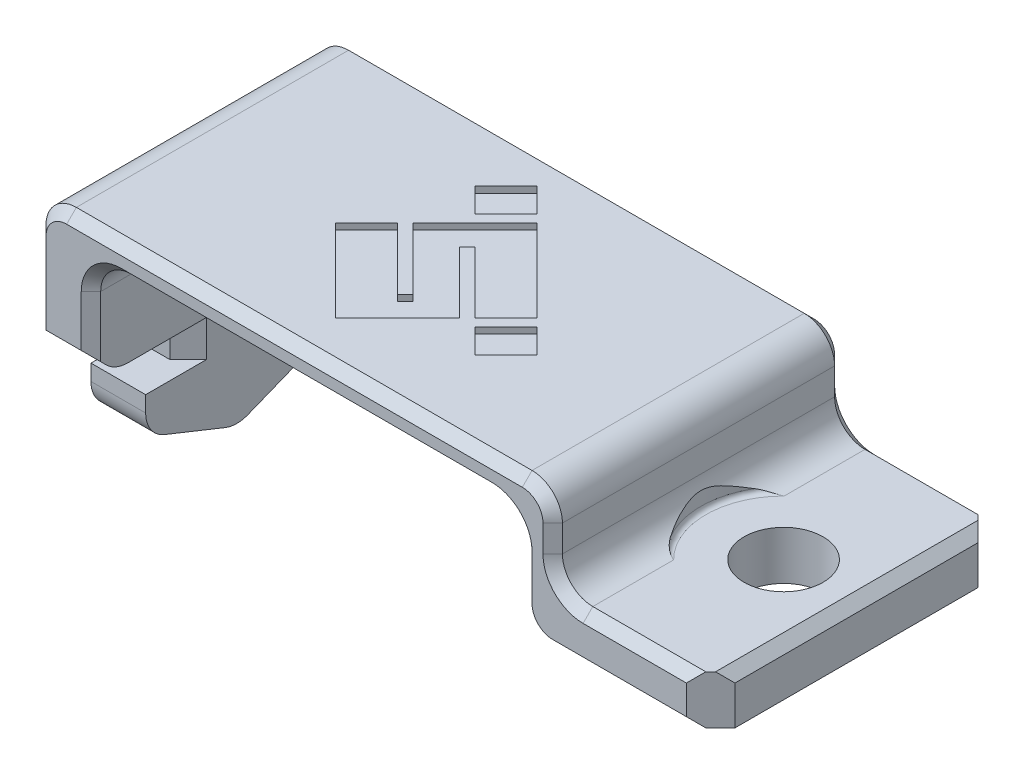
from build123d import *

# Parameters (mm, degrees)
BOSS_BODY_DEPTH           = 12
FILLET1_R                 = 2.5
CUT_NOTCH_DEPTH           = 38.330450037
BOSS_FINGER_DEPTH         = 2.5
BOSS_PRESS_DEPTH          = 12
CHAMFER3_SIZE             = 3
CUT_MOUNT_HOLE_DEPTH      = 38.330450037
CUT_MOUNT_HOLE_DEPTH_BACK = 38.330450037
SKETCH6_R                 = 3.25
FILLET_OVERHANG_R         = 2.5
CHAMFER1_SIZE             = 2
FILLET2_R                 = 2.5
CHAMF_MAIN_FACES_SIZE     = 0.8
CHAMFER4_SIZE             = 1.5
CUT_LOGO_DEPTH            = 0.5
CUT_VERSION_DEPTH         = 0.5


with BuildPart() as part:
    # Sketch1 → boss_body (new, symmetric)
    with BuildSketch(Plane.XY):
        Polygon((-17.75, -9.5), (-17.75, 9.5), (17.75, 9.5), (17.75, 0.8), (33.25, 0.8), (33.25, 4.8), (20.25, 4.8), (20.25, 12), (-22.25, 12), (-22.25, -9.5), align=None)
    extrude(amount=BOSS_BODY_DEPTH, both=True)

    # Fillet1
    fillet1_edges = [part.edges().sort_by_distance(p)[0] for p in [
        (-22.25, 12, 0),
        (20.25, 12, 0),
        (20.25, 4.8, 0),
        (17.75, 9.5, 0),
        (-17.75, 9.5, 0),
    ]]
    fillet(fillet1_edges, radius=FILLET1_R)

    # Sketch2 → cut-notch (cut, through all)
    with BuildSketch(Plane(origin=(0, 0, 0), x_dir=(0, 0, -1), z_dir=(1, 0, 0))):
        Polygon((-7.5, -2.2), (-7.5, -5.2), (0, -8.2), (7.5, -5.2), (7.5, -2.2), (4, -2.2), (4, 0.8), (12, 0.8), (12, -3.635963145), (12, -9.5), (-12, -9.5), (-12, 0.8), (-4, 0.8), (-4, -2.2), align=None)
    extrude(amount=-CUT_NOTCH_DEPTH, mode=Mode.SUBTRACT)

    # Sketch3 → boss_finger (add)
    with BuildSketch(Plane.ZY.offset(-17.75)):
        Polygon((-5, 0.8), (-1, -3.2), (1, -3.2), (5, 0.8), align=None)
    extrude(amount=-BOSS_FINGER_DEPTH)

    # Sketch6 → cut_mount_hole (cut, two sides: drawn at the far end of the back side and taken through both)
    with BuildSketch(Plane(origin=(0, 0, 0), x_dir=(1, 0, 0), z_dir=(0, 1, 0)).offset(-CUT_MOUNT_HOLE_DEPTH_BACK)):
        with Locations(Location((27.25, 0, 0), (0, 0, 90))):
            Circle(SKETCH6_R)
    extrude(amount=CUT_MOUNT_HOLE_DEPTH + CUT_MOUNT_HOLE_DEPTH_BACK, mode=Mode.SUBTRACT)

    # fillet overhang
    fillet_overhang_edges = [part.edges().sort_by_distance(p)[0] for p in [
        (17.75, 0.8, 8.5),
        (17.75, 0.8, -8.5),
    ]]
    fillet(fillet_overhang_edges, radius=FILLET_OVERHANG_R)

    # Chamfer1
    chamfer1_edges = [part.edges().sort_by_distance(p)[0] for p in [
        (33.25, 2.8, -12),
        (33.25, 2.8, 12),
        (-20, 0.8, -12),
        (-20, 0.8, 12),
    ]]
    chamfer(chamfer1_edges, length=CHAMFER1_SIZE)

    # Fillet2
    fillet2_edges = [part.edges().sort_by_distance(p)[0] for p in [
        (-20, 0.8, -10),
        (-20, 0.8, 10),
        (-20, -5.2, 7.5),
        (-20, -8.2, 0),
        (-20, -5.2, -7.5),
    ]]
    fillet(fillet2_edges, radius=FILLET2_R)

    # chamf_main_faces
    chamf_main_faces_edges = [part.edges().sort_by_distance(p)[0] for p in [
        (25.75, 0.8, -12),
        (25.75, 0.8, 12),
        (18.482233047, 1.532233047, 12),
        (18.482233047, 1.532233047, -12),
        (33.25, 4.8, 0),
        (27, 4.8, -12),
        (27, 4.8, 12),
        (-17.75, 4.9, -12),
        (-17.75, 4.9, 12),
        (20.25, 8.4, -12),
        (20.25, 8.4, 12),
        (-1, 12, -12),
        (-1, 12, 12),
        (-22.25, 6.15, -12),
        (17.75, 5.15, -12),
        (0, 9.5, -12),
        (-21.517766953, 11.267766953, -12),
        (19.517766953, 11.267766953, -12),
        (0, 9.5, 12),
        (17.75, 5.15, 12),
        (-22.25, 6.15, 12),
        (-21.517766953, 11.267766953, 12),
        (19.517766953, 11.267766953, 12),
        (20.982233047, 5.532233047, -12),
        (20.982233047, 5.532233047, 12),
        (17.017766953, 8.767766953, -12),
        (17.017766953, 8.767766953, 12),
        (-17.017766953, 8.767766953, -12),
        (-17.017766953, 8.767766953, 12),
    ]]
    chamfer(chamf_main_faces_edges, length=CHAMF_MAIN_FACES_SIZE)

    # Chamfer4
    chamfer4_edges = [part.edges().sort_by_distance(p)[0] for p in [
        (-17.75, -0.7, 4),
        (-22.25, -0.7, 4),
        (-17.75, -0.7, -4),
        (-22.25, -0.7, -4),
    ]]
    chamfer(chamfer4_edges, length=CHAMFER4_SIZE)

    # Sketch7 → m6_clearance (revolve, cut)
    with BuildSketch(Plane.XY):
        with BuildLine():
            Line((27.25, 4.8), (20.85, 4.8))
            ThreePointArc((20.85, 4.8), (20.567157288, 4.917157288), (20.45, 5.2))
            Line((20.45, 5.2), (20.45, 8.8))
            Line((20.45, 8.8), (27.25, 8.8))
            Line((27.25, 8.8), (27.25, 4.8))
        make_face()
    revolve(axis=Axis((27.25, 4.8, 0), (0, -1, 0)), mode=Mode.SUBTRACT)

    # Sketch9 → cut_LOGO (cut)
    with BuildSketch(Plane(origin=(0, 12, 0), x_dir=(1, 0, 0), z_dir=(0, 1, 0))):
        Polygon((-5.421740566, 0.907042417), (-0.330571742, -4.184126407), (0.305824361, -3.547730304), (-4.785344463, 1.54343852), (0.305824361, 6.634607345), (7.094049461, -0.153617755), (4.548465048, -2.699202167), (-0.542703776, 2.391966658), (-1.179099879, 1.755570555), (3.912068945, -3.33559827), (-1.179099879, -8.426767094), (-7.967324979, -1.638541995), align=None)
        Polygon((-2.310470729, 9.250902435), (-0.330571742, 7.271003448), (-2.876156154, 4.725419036), (-4.856055141, 6.705318023), align=None)
        Polygon((9.710344551, -2.769912845), (7.164760139, -5.315497257), (5.184861151, -3.33559827), (7.730445564, -0.790013858), align=None)
    extrude(amount=-CUT_LOGO_DEPTH, mode=Mode.SUBTRACT)

    # Sketch10 → cut_version (cut)
    with BuildSketch(Plane.XZ.offset(-9.5)):
        with BuildLine():
            add(Edge.make_bspline(
                [(-14.851008321, -4.237689198), (-14.849510693, -4.250642601), (-14.846610294, -4.27572897), (-14.8384834, -4.299632501), (-14.834552846, -4.31119339)],
                knots=[0, 0, 0, 0, 1.032704525, 2, 2, 2, 2], degree=3))
            Line((-14.834552846, -4.31119339), (-14.036166159, -6.698768815))
            add(Edge.make_bspline(
                [(-14.036166159, -6.698768815), (-14.027439153, -6.719711122), (-14.010827911, -6.75957333), (-13.965521002, -6.805388656), (-13.909705028, -6.836792705), (-13.867228102, -6.842414168), (-13.845121951, -6.845339731)],
                knots=[0, 0, 0, 0, 1.054683453, 2.007515722, 2.96305683, 4, 4, 4, 4], degree=3))
            add(Edge.make_bspline(
                [(-13.845121951, -6.845339731), (-13.821946344, -6.842462796), (-13.77791748, -6.836997213), (-13.720080391, -6.805920093), (-13.674632812, -6.759562125), (-13.657942961, -6.719838441), (-13.649186992, -6.698998268)],
                knots=[0, 0, 0, 0, 1.06836729, 2.029677035, 2.966312611, 4, 4, 4, 4], degree=3))
            Line((-13.649186992, -6.698998268), (-12.850430323, -4.310568548))
            add(Edge.make_bspline(
                [(-12.850430323, -4.310568548), (-12.847467979, -4.299182453), (-12.84127803, -4.275390694), (-12.840063949, -4.250829517), (-12.839430894, -4.238022658)],
                knots=[0, 0, 0, 0, 0.957146177, 2, 2, 2, 2], degree=3))
            add(Edge.make_bspline(
                [(-12.839430894, -4.238022658), (-12.840513149, -4.224642478), (-12.842607672, -4.198747385), (-12.854807937, -4.161929293), (-12.87241906, -4.127978683), (-12.898096672, -4.09899106), (-12.928280689, -4.074515682), (-12.962352667, -4.055193007), (-13.001208379, -4.044819109), (-13.027996369, -4.042484031), (-13.041869919, -4.04127469)],
                knots=[0, 0, 0, 0, 1.027789528, 1.989114056, 2.957849911, 3.946954469, 4.938684973, 5.935646619, 6.930867606, 8, 8, 8, 8], degree=3))
            add(Edge.make_bspline(
                [(-13.041869919, -4.04127469), (-13.063921833, -4.044287864), (-13.106166507, -4.050060176), (-13.162795828, -4.080245643), (-13.207225975, -4.127043825), (-13.224109634, -4.166835597), (-13.232926829, -4.187616154)],
                knots=[0, 0, 0, 0, 1.03692919, 1.986436811, 2.948451835, 4, 4, 4, 4], degree=3))
            Line((-13.232926829, -4.187616154), (-13.845099721, -6.009218034))
            Line((-13.845099721, -6.009218034), (-14.452016641, -4.187234262))
            add(Edge.make_bspline(
                [(-14.452016641, -4.187234262), (-14.460984425, -4.16657545), (-14.478249838, -4.126801641), (-14.523590639, -4.079943592), (-14.582230408, -4.049827719), (-14.626053694, -4.044229736), (-14.649186992, -4.04127469)],
                knots=[0, 0, 0, 0, 1.028913269, 1.980936724, 2.934183284, 4, 4, 4, 4], degree=3))
            add(Edge.make_bspline(
                [(-14.649186992, -4.04127469), (-14.662519835, -4.042496339), (-14.688503341, -4.044877131), (-14.726503219, -4.055343464), (-14.760433978, -4.07472833), (-14.791327925, -4.098930726), (-14.817711885, -4.127950064), (-14.836391525, -4.161711831), (-14.848399917, -4.198772275), (-14.850526959, -4.224650957), (-14.851008321, -4.237689198)],
                knots=[0, 0, 0, 0, 1.030543514, 2.008358934, 3.007991962, 4.018680577, 5.024181706, 6.005556065, 6.969456486, 8, 8, 8, 8], degree=3))
        make_face()
        with BuildLine():
            add(Edge.make_bspline(
                [(-11.82333905, -3.695182528), (-11.83267289, -3.704485782), (-11.851155193, -3.722907521), (-11.871007144, -3.757086289), (-11.882445754, -3.795589802), (-11.884639454, -3.822499517), (-11.885772358, -3.836396642)],
                knots=[0, 0, 0, 0, 0.992164211, 1.96462331, 2.948859839, 4, 4, 4, 4], degree=3))
            add(Edge.make_bspline(
                [(-11.885772358, -3.836396642), (-11.884679287, -3.850311158), (-11.882562718, -3.87725455), (-11.870583694, -3.91549404), (-11.852817897, -3.950495641), (-11.827077267, -3.980137182), (-11.797432861, -4.005895186), (-11.762425379, -4.023595181), (-11.724240999, -4.035819418), (-11.697255506, -4.037272826), (-11.683333333, -4.038022658)],
                knots=[0, 0, 0, 0, 1.0530203, 2.0390173, 3.01127151, 4.001099292, 4.990927074, 5.963181283, 6.949178283, 8, 8, 8, 8], degree=3))
            add(Edge.make_bspline(
                [(-11.683333333, -4.038022658), (-11.668876995, -4.036639992), (-11.640821824, -4.033956676), (-11.601356851, -4.021541028), (-11.566018655, -4.002684568), (-11.546693244, -3.985074373), (-11.53699187, -3.97623404)],
                knots=[0, 0, 0, 0, 1.06971459, 2.075976935, 3.034138695, 4, 4, 4, 4], degree=3))
            Line((-11.53699187, -3.97623404), (-11.072953189, -3.501333284))
            Line((-11.072953189, -3.501333284), (-11.072953189, -6.642707776))
            add(Edge.make_bspline(
                [(-11.072953189, -6.642707776), (-11.072125061, -6.656689848), (-11.070523803, -6.683725402), (-11.05839408, -6.72203276), (-11.040543394, -6.756701394), (-11.015761185, -6.786937016), (-10.986131809, -6.812093635), (-10.951928166, -6.83018716), (-10.914441026, -6.842121481), (-10.888032281, -6.844243536), (-10.874390244, -6.845339731)],
                knots=[0, 0, 0, 0, 1.064897874, 2.059072668, 3.039390689, 4.024276954, 5.022314302, 5.984364611, 6.958777708, 8, 8, 8, 8], degree=3))
            add(Edge.make_bspline(
                [(-10.874390244, -6.845339731), (-10.860758639, -6.844209483), (-10.834111371, -6.842000058), (-10.796244417, -6.830376547), (-10.761863409, -6.812065292), (-10.732117867, -6.786982574), (-10.707663161, -6.75645035), (-10.688300065, -6.722428492), (-10.677936969, -6.683559386), (-10.675600372, -6.65677328), (-10.674390244, -6.642900707)],
                knots=[0, 0, 0, 0, 1.038553346, 2.030179789, 2.989764092, 3.985243189, 4.967604913, 5.955148361, 6.940967594, 8, 8, 8, 8], degree=3))
            Line((-10.674390244, -6.642900707), (-10.674390244, -3.044887972))
            add(Edge.make_bspline(
                [(-10.674390244, -3.044887972), (-10.675632713, -3.031441958), (-10.678067627, -3.005091307), (-10.688284129, -2.966611433), (-10.707705574, -2.932651846), (-10.731856851, -2.902025519), (-10.762149659, -2.877867847), (-10.796213335, -2.859497816), (-10.834069834, -2.847680431), (-10.860754169, -2.846131339), (-10.874390244, -2.845339731)],
                knots=[0, 0, 0, 0, 1.033276339, 2.024949948, 3.018358012, 4.006553579, 4.994749146, 5.960032027, 6.957547333, 8, 8, 8, 8], degree=3))
            add(Edge.make_bspline(
                [(-10.874390244, -2.845339731), (-10.888023181, -2.84613127), (-10.914442068, -2.847665173), (-10.952137, -2.859323021), (-10.985297274, -2.879247689), (-11.00345026, -2.897243307), (-11.012601626, -2.906315341)],
                knots=[0, 0, 0, 0, 1.049879887, 2.034532876, 3.009159723, 4, 4, 4, 4], degree=3))
            Line((-11.012601626, -2.906315341), (-11.82333905, -3.695182528))
        make_face()
        with BuildLine():
            add(Edge.make_bspline(
                [(-9.728728404, -6.635056449), (-9.728012298, -6.649144484), (-9.726619201, -6.676551023), (-9.714651661, -6.7153126), (-9.696460833, -6.750535574), (-9.671312956, -6.780997064), (-9.641066861, -6.806504311), (-9.606369893, -6.825602642), (-9.56752699, -6.837268615), (-9.540323434, -6.838843783), (-9.526422764, -6.839648674)],
                knots=[0, 0, 0, 0, 1.053795159, 2.050028647, 3.013195991, 4.009429478, 4.990006149, 5.962765968, 6.958999455, 8, 8, 8, 8], degree=3))
            add(Edge.make_bspline(
                [(-9.526422764, -6.839648674), (-9.512512571, -6.838877458), (-9.485550297, -6.837382603), (-9.447077344, -6.825414812), (-9.41258711, -6.806520991), (-9.382346223, -6.780992542), (-9.357199819, -6.750536569), (-9.338998029, -6.715312975), (-9.327125464, -6.67671294), (-9.325584276, -6.649492785), (-9.324796748, -6.635583633)],
                knots=[0, 0, 0, 0, 1.045213593, 2.025948432, 3.002645121, 3.987190297, 4.987455656, 5.954521048, 6.954786407, 8, 8, 8, 8], degree=3))
            Line((-9.324796748, -6.635583633), (-9.324117124, -6.43614734))
            add(Edge.make_bspline(
                [(-9.324117124, -6.43614734), (-9.325169736, -6.421780314), (-9.327215087, -6.393863464), (-9.339020065, -6.354304414), (-9.356744261, -6.318421207), (-9.382432123, -6.288548397), (-9.41260967, -6.263729392), (-9.447295228, -6.245902463), (-9.48552471, -6.233733642), (-9.512503863, -6.232272444), (-9.526422764, -6.231518593)],
                knots=[0, 0, 0, 0, 1.076562654, 2.091889952, 3.072719245, 4.052917712, 5.020200157, 5.982996012, 6.959400964, 8, 8, 8, 8], degree=3))
            add(Edge.make_bspline(
                [(-9.526422764, -6.231518593), (-9.540332156, -6.232306133), (-9.567552782, -6.233847345), (-9.606149441, -6.24571974), (-9.641044779, -6.263746158), (-9.671224742, -6.288544112), (-9.696925288, -6.31842129), (-9.714595494, -6.354308438), (-9.726632216, -6.393903618), (-9.728103231, -6.421939426), (-9.728861789, -6.436396642)],
                knots=[0, 0, 0, 0, 1.037498569, 2.03038068, 2.990307883, 3.954708309, 4.931986273, 5.909893183, 6.922195311, 8, 8, 8, 8], degree=3))
            Line((-9.728861789, -6.436396642), (-9.728728404, -6.635056449))
        make_face()
        with BuildLine():
            add(Edge.make_bspline(
                [(-8.337160188, -3.695182528), (-8.346494028, -3.704485782), (-8.364976331, -3.722907521), (-8.384828282, -3.757086289), (-8.396266892, -3.795589802), (-8.398460592, -3.822499517), (-8.399593496, -3.836396642)],
                knots=[0, 0, 0, 0, 0.992164211, 1.96462331, 2.948859839, 4, 4, 4, 4], degree=3))
            add(Edge.make_bspline(
                [(-8.399593496, -3.836396642), (-8.398500425, -3.850311158), (-8.396383856, -3.87725455), (-8.384404833, -3.91549404), (-8.366639035, -3.950495641), (-8.340898405, -3.980137182), (-8.311253999, -4.005895186), (-8.276246518, -4.023595181), (-8.238062137, -4.035819418), (-8.211076644, -4.037272826), (-8.197154472, -4.038022658)],
                knots=[0, 0, 0, 0, 1.0530203, 2.0390173, 3.01127151, 4.001099292, 4.990927074, 5.963181283, 6.949178283, 8, 8, 8, 8], degree=3))
            add(Edge.make_bspline(
                [(-8.197154472, -4.038022658), (-8.182698133, -4.036639992), (-8.154642962, -4.033956676), (-8.11517799, -4.021541028), (-8.079839793, -4.002684568), (-8.060514382, -3.985074373), (-8.050813008, -3.97623404)],
                knots=[0, 0, 0, 0, 1.06971459, 2.075976935, 3.034138695, 4, 4, 4, 4], degree=3))
            Line((-8.050813008, -3.97623404), (-7.586774327, -3.501333284))
            Line((-7.586774327, -3.501333284), (-7.586774327, -6.642707776))
            add(Edge.make_bspline(
                [(-7.586774327, -6.642707776), (-7.585946199, -6.656689848), (-7.584344941, -6.683725402), (-7.572215218, -6.72203276), (-7.554364532, -6.756701394), (-7.529582323, -6.786937016), (-7.499952947, -6.812093635), (-7.465749305, -6.83018716), (-7.428262164, -6.842121481), (-7.401853419, -6.844243536), (-7.388211382, -6.845339731)],
                knots=[0, 0, 0, 0, 1.064897874, 2.059072668, 3.039390689, 4.024276954, 5.022314302, 5.984364611, 6.958777708, 8, 8, 8, 8], degree=3))
            add(Edge.make_bspline(
                [(-7.388211382, -6.845339731), (-7.374579777, -6.844209483), (-7.347932509, -6.842000058), (-7.310065555, -6.830376547), (-7.275684547, -6.812065292), (-7.245939005, -6.786982574), (-7.221484299, -6.75645035), (-7.202121204, -6.722428492), (-7.191758108, -6.683559386), (-7.18942151, -6.65677328), (-7.188211382, -6.642900707)],
                knots=[0, 0, 0, 0, 1.038553346, 2.030179789, 2.989764092, 3.985243189, 4.967604913, 5.955148361, 6.940967594, 8, 8, 8, 8], degree=3))
            Line((-7.188211382, -6.642900707), (-7.188211382, -3.044887972))
            add(Edge.make_bspline(
                [(-7.188211382, -3.044887972), (-7.189453852, -3.031441958), (-7.191888765, -3.005091307), (-7.202105268, -2.966611433), (-7.221526712, -2.932651846), (-7.245677989, -2.902025519), (-7.275970797, -2.877867847), (-7.310034473, -2.859497816), (-7.347890972, -2.847680431), (-7.374575307, -2.846131339), (-7.388211382, -2.845339731)],
                knots=[0, 0, 0, 0, 1.033276339, 2.024949948, 3.018358012, 4.006553579, 4.994749146, 5.960032027, 6.957547333, 8, 8, 8, 8], degree=3))
            add(Edge.make_bspline(
                [(-7.388211382, -2.845339731), (-7.401844319, -2.84613127), (-7.428263206, -2.847665173), (-7.465958138, -2.859323021), (-7.499118412, -2.879247689), (-7.517271398, -2.897243307), (-7.526422764, -2.906315341)],
                knots=[0, 0, 0, 0, 1.049879887, 2.034532876, 3.009159723, 4, 4, 4, 4], degree=3))
            Line((-7.526422764, -2.906315341), (-8.337160188, -3.695182528))
        make_face()
    extrude(amount=-CUT_VERSION_DEPTH, mode=Mode.SUBTRACT)


with BuildPart() as body_2:
    # Sketch4 → boss_press (new, symmetric)
    with BuildSketch(Plane.XY):
        Polygon((-3, 9.5), (-1, 7.5), (1, 7.5), (3, 9.5), align=None)
    extrude(amount=BOSS_PRESS_DEPTH, both=True)

    # Chamfer3
    # the kernel refuses this chamfer: 3 mm, written as the material it takes off along each edge
    with BuildSketch(Plane(origin=(-8.715048964, 7.5, -12), x_dir=(0, -0.027495876610586494, 0.9996219169112968), z_dir=(1, 0, 0)), Plane(origin=(-8.715048964, 7.5, 12), x_dir=(0, 0.9996219169112969, 0.02749587661058621), z_dir=(1, 0, 0))) as chamfer3_piece_1:
        Polygon((CHAMFER3_SIZE * 0.999621916911, -CHAMFER3_SIZE * 0.0274958766106), (-CHAMFER3_SIZE * 0.0274958766106, -CHAMFER3_SIZE * 0.999621916911), (0, 0), align=None)
    extrude(amount=17.430097928, mode=Mode.SUBTRACT)


solid = Compound([part.part, body_2.part])
